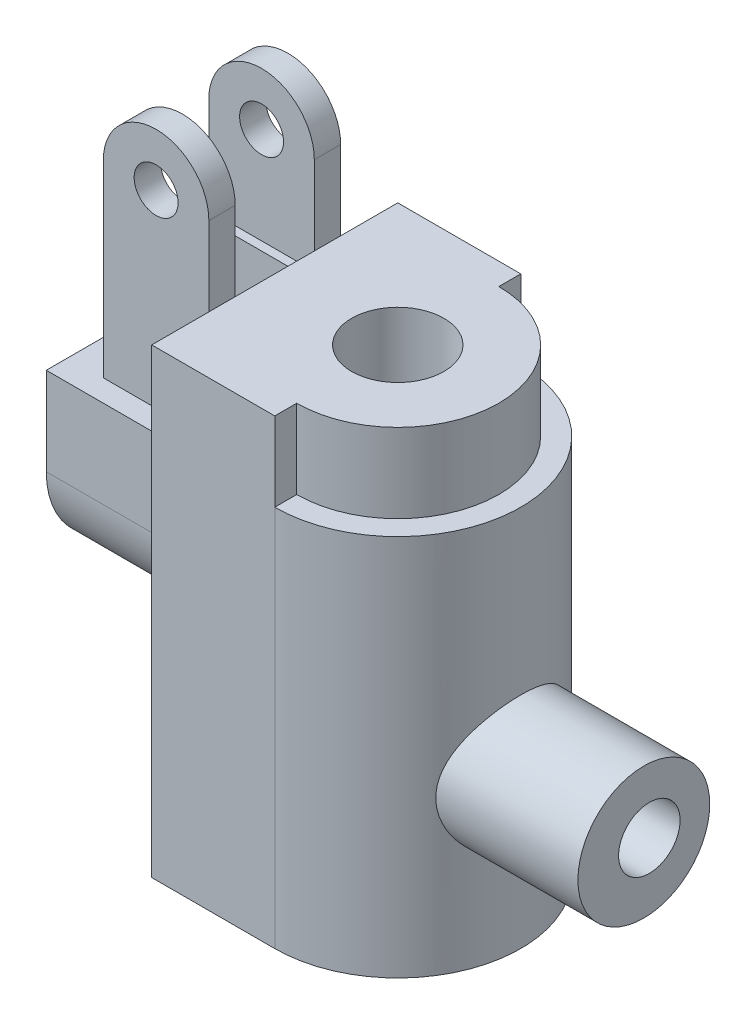
from build123d import *
from build123d.topology import SkipClean

# Parameters (mm, degrees)
EXTRUDE_1_DEPTH          = 105
SKETCH_2_W               = 40
SKETCH_2_H               = 20
EXTRUDE_2_DEPTH          = 32
EXTRUDE_4_REACH          = 141.832
SKETCH_3_R               = 15
EXTRUDE_START            = 28
EXTRUDE_5_DEPTH          = 28
EXTRUDE_START_2          = 7
SKETCH_5_W               = 24
SKETCH_5_H               = 43
EXTRUDE_6_DEPTH          = 8
SKETCH_6_W               = 24
SKETCH_6_H               = 50
CUT_EXTRUDE_1_DEPTH      = 9
CUT_EXTRUDE_2_DEPTH      = 159.031642473
CUT_EXTRUDE_2_DEPTH_BACK = 159.031642473
SKETCH_7_R               = 5
RIB_1_REACH              = 156.625
SKETCH_8_WALL_W          = 356.93996261
SKETCH_8_WALL_H          = 6
CUT_EXTRUDE_START        = -18
CUT_EXTRUDE_3_DEPTH      = 18
HOLE_WIZARD_M36_2_D      = 32
HOLE_WIZARD_M36_2_DEPTH  = 55
HOLE_WIZARD_M36_2_TIP    = 9.613769904
SKETCH_14_R              = 11.5
CUT_EXTRUDE_4_DEPTH      = 78
HOLE_WIZARD_M24_1_D      = 21
HOLE_WIZARD_M24_1_DEPTH  = 16
HOLE_WIZARD_M24_1_TIP    = 6.3090365
CUT_EXTRUDE_5_DEPTH      = 130.263297345
CUT_EXTRUDE_5_DEPTH_BACK = 130.263297345
SKETCH_16_R              = 5
HOLE_WIZARD_M16_1_REACH  = 139.824
HOLE_WIZARD_M16_1_BORE_R = 7
HOLE_WIZARD_M16_2_REACH  = 157.802
HOLE_WIZARD_M16_2_BORE_R = 7


with BuildPart() as part:
    # 草图1 → 凸台-拉伸1 (new body)
    with BuildSketch(Plane(origin=(0, 0, 0), x_dir=(1, 0, 0), z_dir=(0, 1, 0))):
        with BuildLine():
            Line((-14, 28), (14, 28))
            ThreePointArc((14, 28), (42, 0), (14, -28))
            Line((14, -28), (-14, -28))
            Line((-14, -28), (-14, 28))
        make_face()
    extrude(amount=EXTRUDE_1_DEPTH)

    # 草图2 → 凸台-拉伸2 (add)
    with BuildSketch(Plane.ZY.offset(14)):
        with BuildLine():
            ThreePointArc((20, 60), (0, 40), (-20, 60))
            Line((-20, 60), (20, 60))
        make_face()
        with Locations((0, 70)):
            Rectangle(SKETCH_2_W, SKETCH_2_H)
    extrude(amount=EXTRUDE_2_DEPTH)

    # 草图3 → 凸台-拉伸4 (add, up to next)
    with BuildSketch(Plane(origin=(42, 0, 0), x_dir=(0, 0, -1), z_dir=(1, 0, 0)), mode=Mode.PRIVATE) as extrude_4_sk1:
        with Locations((0, 35)):
            Circle(SKETCH_3_R)
    extrude_4_tool1 = extrude(extrude_4_sk1.sketch, amount=-EXTRUDE_4_REACH, mode=Mode.PRIVATE) - part.part
    add(extrude_4_tool1.solids().sort_by_distance((42, 35, 0))[0])
    add(extrude_4_tool1.solids().sort_by_distance((42, 35, 0))[1])

    # 草图4 → 凸台-拉伸5 (add)
    with SkipClean():  # the faces are left unmerged after this step: merging them gives an invalid solid
        with BuildSketch(Plane(origin=(42, 0, 0), x_dir=(0, 0, -1), z_dir=(1, 0, 0)).offset(EXTRUDE_START)):
            with BuildLine():
                ThreePointArc((0, 50), (-15, 35), (0, 20))
                ThreePointArc((0, 20), (15, 35), (0, 50))
            make_face()
        extrude(amount=-EXTRUDE_5_DEPTH)

    # 草图5 → 凸台-拉伸6 (add)
    with BuildSketch(Plane.XY.offset(EXTRUDE_START_2)):
        with Locations((-26, 101.5)):
            Rectangle(SKETCH_5_W, SKETCH_5_H)
        with BuildLine():
            Line((-38, 123), (-14, 123))
            ThreePointArc((-14, 123), (-26, 135), (-38, 123))
        make_face()
    extrude_6 = extrude(amount=EXTRUDE_6_DEPTH)

    # 镜向1: 凸台-拉伸6 across plane
    add(extrude_6.mirror(Plane.XY))

    # 草图6 → 切除-拉伸1 (cut, symmetric)
    with BuildSketch(Plane.XY):
        with Locations((-26, 126)):
            Rectangle(SKETCH_6_W, SKETCH_6_H)
    extrude(amount=CUT_EXTRUDE_1_DEPTH, both=True, mode=Mode.SUBTRACT)

    # 草图7 → 切除-拉伸2 (cut, two sides: drawn at the far end of the back side and taken through both)
    with BuildSketch(Plane.XY.offset(15).offset(-CUT_EXTRUDE_2_DEPTH_BACK)):
        with Locations((-26, 123)):
            Circle(SKETCH_7_R)
    extrude(amount=CUT_EXTRUDE_2_DEPTH + CUT_EXTRUDE_2_DEPTH_BACK, mode=Mode.SUBTRACT)

    # 草图8 wall → 筋1 (add, up to next)
    with BuildSketch(Plane(origin=(-28.684243545, 22.5, 0), x_dir=(-0.642787609684, 0.766044443121, 0), z_dir=(-0.766044443121, -0.642787609684, 0)), mode=Mode.PRIVATE) as rib_1_sk1:
        Rectangle(SKETCH_8_WALL_W, SKETCH_8_WALL_H)
    rib_1_tool1 = extrude(rib_1_sk1.sketch, amount=-RIB_1_REACH, mode=Mode.PRIVATE) - part.part
    add(rib_1_tool1.solids().sort_by_distance((-28.684243545, 22.5, 0))[0])

    # 草图9 → 切除-拉伸3 (cut)
    with BuildSketch(Plane(origin=(0, 105, 0), x_dir=(1, 0, 0), z_dir=(0, 1, 0)).offset(CUT_EXTRUDE_START)):
        with BuildLine():
            Line((14, 23), (14, 28))
            ThreePointArc((14, 28), (42, 0), (14, -28))
            Line((14, -28), (14, -23))
            ThreePointArc((14, -23), (37, 0), (14, 23))
        make_face()
    extrude(amount=CUT_EXTRUDE_3_DEPTH, mode=Mode.SUBTRACT)

    # M36 螺纹孔2
    with Locations(Plane(origin=(14, 0, 0), x_dir=(0, 0, -1), z_dir=(0, -1, 0))):
        with Locations((0, 0)):
            Hole(HOLE_WIZARD_M36_2_D / 2, depth=HOLE_WIZARD_M36_2_DEPTH)
            with Locations((0, 0, -(HOLE_WIZARD_M36_2_DEPTH + HOLE_WIZARD_M36_2_TIP / 2))):  # 118° drill point
                Cone(0, HOLE_WIZARD_M36_2_D / 2, HOLE_WIZARD_M36_2_TIP, mode=Mode.SUBTRACT)

    # 草图14 → 切除-拉伸4 (cut)
    with BuildSketch(Plane.XZ):
        with Locations(Location((14, 0, 0), (0, 0, 270))):
            Circle(SKETCH_14_R)
    extrude(amount=-CUT_EXTRUDE_4_DEPTH, mode=Mode.SUBTRACT)

    # M24 螺纹孔1
    with Locations(Plane(origin=(14, 105, 0), x_dir=(0, 0, 1), z_dir=(0, 1, 0))):
        with Locations((0, 0)):
            Hole(HOLE_WIZARD_M24_1_D / 2, depth=HOLE_WIZARD_M24_1_DEPTH)
            with Locations((0, 0, -(HOLE_WIZARD_M24_1_DEPTH + HOLE_WIZARD_M24_1_TIP / 2))):  # 118° drill point
                Cone(0, HOLE_WIZARD_M24_1_D / 2, HOLE_WIZARD_M24_1_TIP, mode=Mode.SUBTRACT)

    # 草图16 → 切除-拉伸5 (cut, two sides: drawn at the far end of the back side and taken through both)
    with BuildSketch(Plane(origin=(0, 105, 0), x_dir=(1, 0, 0), z_dir=(0, 1, 0)).offset(-CUT_EXTRUDE_5_DEPTH_BACK)):
        with Locations(Location((14, 0, 0), (0, 0, 270))):
            Circle(SKETCH_16_R)
    extrude(amount=CUT_EXTRUDE_5_DEPTH + CUT_EXTRUDE_5_DEPTH_BACK, mode=Mode.SUBTRACT)

    # M16 螺纹孔1 bore (on position points) → M16 螺纹孔1 (cut, up to next)
    with BuildSketch(Plane(origin=(-46, 68.934751758, -0.063559522), x_dir=(0, 0, -1), z_dir=(-1, 0, 0)), mode=Mode.PRIVATE) as hole_wizard_m16_1_sk1:
        Circle(HOLE_WIZARD_M16_1_BORE_R)
    hole_wizard_m16_1_tool1 = extrude(hole_wizard_m16_1_sk1.sketch, amount=-HOLE_WIZARD_M16_1_REACH, mode=Mode.PRIVATE) & part.part
    add(hole_wizard_m16_1_tool1.solids().sort_by_distance((-46, 68.934752, -0.06356))[0], mode=Mode.SUBTRACT)

    # M16 螺纹孔2 bore (on position points) → M16 螺纹孔2 (cut, up to next)
    with BuildSketch(Plane(origin=(70, 35.189243523, -1.257452157), x_dir=(0, 0, 1), z_dir=(1, 0, 0)), mode=Mode.PRIVATE) as hole_wizard_m16_2_sk1:
        Circle(HOLE_WIZARD_M16_2_BORE_R)
    hole_wizard_m16_2_tool1 = extrude(hole_wizard_m16_2_sk1.sketch, amount=-HOLE_WIZARD_M16_2_REACH, mode=Mode.PRIVATE) & part.part
    add(hole_wizard_m16_2_tool1.solids().sort_by_distance((70, 35.189244, -1.257452))[0], mode=Mode.SUBTRACT)


solid = part.part
